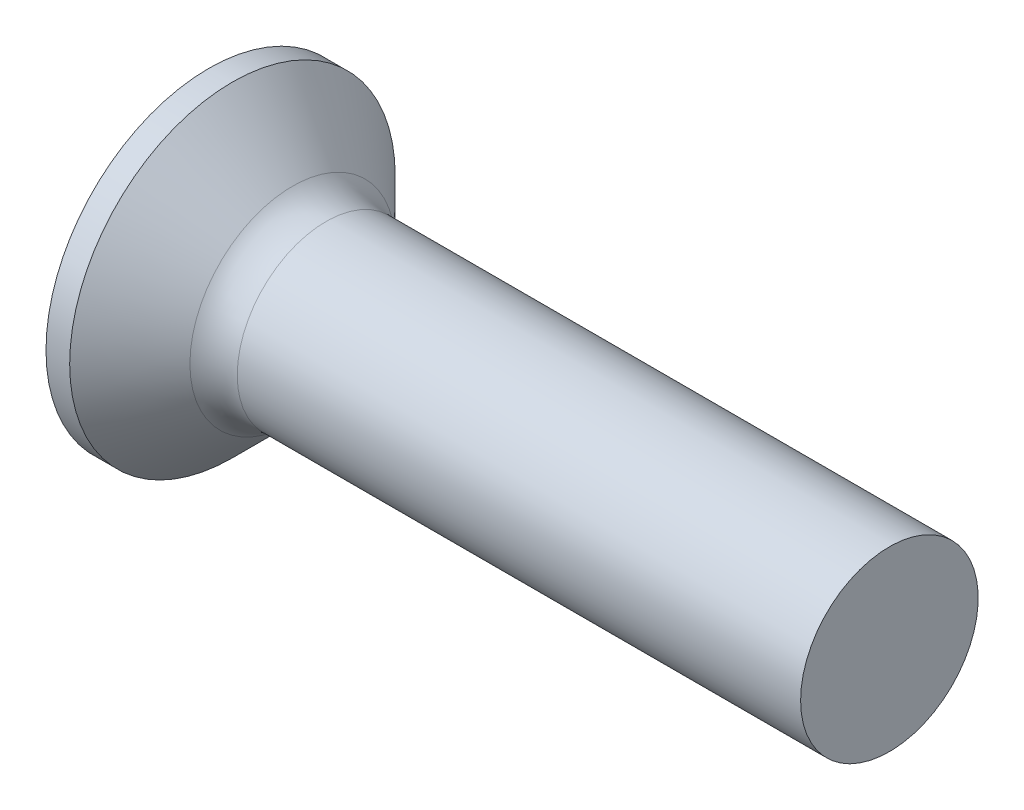
from build123d import *

# Parameters (mm, degrees)
FILLET1_R    = 0.8
RECPAT_COUNT = 2
RECPAT_ANGLE = 90


with BuildPart() as part:
    # BodySke → Base-Revolve (revolve)
    with BuildSketch(Plane.XY):
        Polygon((0, 0), (0, 2.75), (0.4, 2.75), (1.65, 1.5), (11.5, 1.5), (11.5, 0), align=None)
    revolve(axis=Axis((-6.35, 0, 0), (1, 0, 0)))

    # Fillet1
    fillet1_edges = [part.edges().sort_by_distance(p)[0] for p in [
        (1.65, -1.5, 0),
    ]]
    fillet(fillet1_edges, radius=FILLET1_R)

    # Sketch3 → Recess section 0
    with BuildSketch(Plane.ZY):
        with BuildLine():
            Line((-0.37, 1.5), (0.37, 1.5))
            Line((0.37, 1.5), (0.37, -1.5))
            Line((0.37, -1.5), (-0.37, -1.5))
            Line((-0.37, -1.5), (-0.37, 1.5))
        make_face()
    # Sketch4 → Recess section 1
    with BuildSketch(Plane.ZY.offset(-2.01)):
        with BuildLine():
            Line((-0.37, 0.497851135), (0.37, 0.497851135))
            Line((0.37, 0.497851135), (0.37, -0.497851135))
            Line((0.37, -0.497851135), (-0.37, -0.497851135))
            Line((-0.37, -0.497851135), (-0.37, 0.497851135))
        make_face()
    recess = loft(mode=Mode.SUBTRACT)

    # RecPat: Recess ×2 about axis
    recpat_axis = Axis((0, 0, 0), (1, 0, 0))
    for i in range(1, RECPAT_COUNT):
        add(recess.rotate(recpat_axis, i * RECPAT_ANGLE / (RECPAT_COUNT - 1)), mode=Mode.SUBTRACT)

    # RecCorSke → RecessCore (revolve, cut)
    with BuildSketch(Plane.XY):
        Polygon((0, 0), (0, 0.696552892), (2.01, 0.556), (2.190655351, 0), align=None)
    revolve(axis=Axis((-3.175, 0, 0), (1, 0, 0)), mode=Mode.SUBTRACT)


solid = part.part
